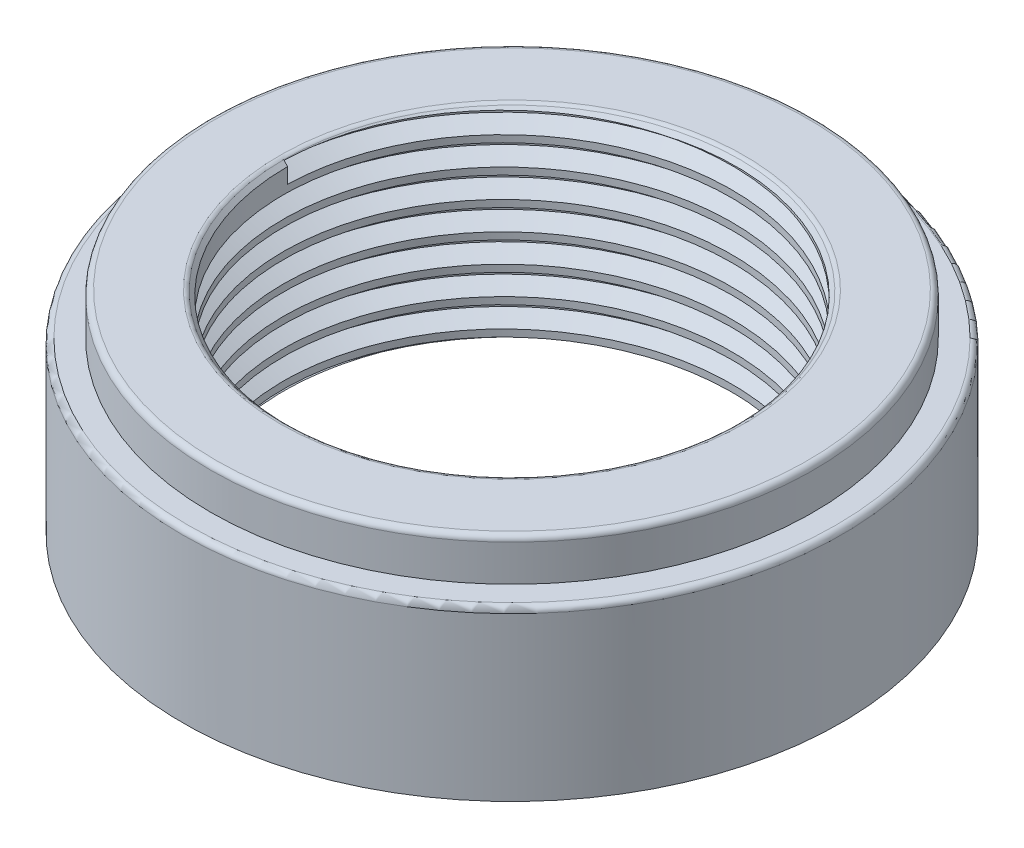
from build123d import *

# Parameters (mm, degrees)
SKETCH1_R           = 29.845
BOSS_EXTRUDE1_DEPTH = 19.05
CUT_EXTRUDE2_START  = -3.81
SKETCH16_R          = 29.845
SKETCH16_R_2        = 27.305
CUT_EXTRUDE2_DEPTH  = 3.81
SKETCH18_R          = 20.32
CUT_EXTRUDE3_DEPTH  = 47.30713282
THREAD2_PITCH       = 2.54
CHAMFER4_SIZE       = 0.508
FILLET3_R           = 0.508


with BuildPart() as part:
    # Sketch1 → Boss-Extrude1 (new body)
    with BuildSketch(Plane(origin=(0, 0, 0), x_dir=(1, 0, 0), z_dir=(0, 1, 0))):
        with Locations(Location((0, 0, 0), (0, 0, 90))):
            Circle(SKETCH1_R)
    extrude(amount=BOSS_EXTRUDE1_DEPTH)

    # Sketch16 → Cut-Extrude2 (cut)
    with BuildSketch(Plane(origin=(0, 19.05, 0), x_dir=(1, 0, 0), z_dir=(0, 1, 0)).offset(CUT_EXTRUDE2_START)):
        with Locations(Location((0, 0, 0), (0, 0, 90))):
            Circle(SKETCH16_R)
        with Locations(Location((0, 0, 0), (0, 0, 270))):
            Circle(SKETCH16_R_2, mode=Mode.SUBTRACT)
    extrude(amount=CUT_EXTRUDE2_DEPTH, mode=Mode.SUBTRACT)

    # Sketch18 → Cut-Extrude3 (cut, through all)
    with BuildSketch(Plane(origin=(0, 19.05, 0), x_dir=(1, 0, 0), z_dir=(0, 1, 0))):
        with Locations(Location((0, 0, 0), (0, 0, 270))):
            Circle(SKETCH18_R)
    extrude(amount=-CUT_EXTRUDE3_DEPTH, mode=Mode.SUBTRACT)

    # Thread2: the profile of Thread Profile2 profile screwed along a right-hand helix of 7.5 turns, 10 arcs to a turn; built about Z, then put on its axis
    thread2_z = Axis((0, 0, 0), (0, 0, 1))
    thread2_corners = [(20.3197, 0, -0.000173205), (21.694815322, 0, 0.793749997), (21.694815322, 0, 1.111249997), (20.3197, 0, 1.905173198)]
    with BuildLine(mode=Mode.PRIVATE) as thread2_profile:
        Line(thread2_corners[0], thread2_corners[1])
        Line(thread2_corners[1], thread2_corners[2])
        Line(thread2_corners[2], thread2_corners[3])
        Line(thread2_corners[3], thread2_corners[0])
    thread2_cap = Face(thread2_profile.wire())
    thread2_turn_angles = [0, 18, 36, 54, 72, 90, 108, 126, 144, 162, 180, 198, 216, 234, 252, 270, 288, 306, 324, 342, 360]
    thread2_turn_weights = [1, 0.9510565162951535, 1, 0.9510565162951535, 1, 0.9510565162951535, 1, 0.9510565162951535, 1, 0.9510565162951535, 1, 0.9510565162951535, 1, 0.9510565162951535, 1, 0.9510565162951535, 1, 0.9510565162951535, 1, 0.9510565162951535, 1]
    thread2_turn_rails = [Edge.make_bspline([Vector(p[0], p[1], 0).rotate(thread2_z, thread2_turn_angles[k]) / thread2_turn_weights[k] + Vector(0, 0, p[2] + THREAD2_PITCH * thread2_turn_angles[k] / 360) for k in range(21)], [0, 0, 0, 1, 1, 2, 2, 3, 3, 4, 4, 5, 5, 6, 6, 7, 7, 8, 8, 9, 9, 10, 10, 10], 2, thread2_turn_weights) for p in thread2_corners]
    thread2_turn_sides = [Face.make_surface_from_curves(thread2_turn_rails[p[0]], thread2_turn_rails[p[1]]) for p in [(0, 1), (1, 2), (2, 3), (3, 0)]]
    thread2_last_angles = [2520, 2538, 2556, 2574, 2592, 2610, 2628, 2646, 2664, 2682, 2700]
    thread2_last_weights = [1, 0.9510565162951535, 1, 0.9510565162951535, 1, 0.9510565162951535, 1, 0.9510565162951535, 1, 0.9510565162951535, 1]
    thread2_last_rails = [Edge.make_bspline([Vector(p[0], p[1], 0).rotate(thread2_z, thread2_last_angles[k]) / thread2_last_weights[k] + Vector(0, 0, p[2] + THREAD2_PITCH * thread2_last_angles[k] / 360) for k in range(11)], [0, 0, 0, 1, 1, 2, 2, 3, 3, 4, 4, 5, 5, 5], 2, thread2_last_weights) for p in thread2_corners]
    thread2_last_sides = [Face.make_surface_from_curves(thread2_last_rails[p[0]], thread2_last_rails[p[1]]) for p in [(0, 1), (1, 2), (2, 3), (3, 0)]]
    thread2 = Plane(origin=(0, 19.05, 0), x_dir=(-1, 0, 0), z_dir=(0, -1, 0)) * Solid(Shell([*[p.moved(Location((0, 0, THREAD2_PITCH * i))) for i in range(7) for p in thread2_turn_sides], *thread2_last_sides, thread2_cap, thread2_cap.rotate(thread2_z, 2700).moved(Location((0, 0, THREAD2_PITCH * 2700 / 360)))]))
    add(thread2, mode=Mode.SUBTRACT)

    # Chamfer4
    # the kernel refuses this chamfer: 0.508 mm, written as the material it takes off along each edge
    with BuildSketch(Plane(origin=(0, 19.05, 0), x_dir=(0, 0, 1), z_dir=(-1, 0, 0))) as chamfer4_piece_1:
        Polygon((20.32 + CHAMFER4_SIZE, 0), (20.32, -CHAMFER4_SIZE), (20.32, 0), align=None)
    revolve(axis=Axis((0, 19.05, 0), (0, 1, 0)), revolution_arc=270, mode=Mode.SUBTRACT)
    with BuildSketch(Plane(origin=(0, 19.05, 0), x_dir=(-1, 0, 0), z_dir=(0, 0, -1))) as chamfer4_piece_2:
        Polygon((20.32 + CHAMFER4_SIZE, 0), (20.32, -CHAMFER4_SIZE), (20.32, 0), align=None)
    revolve(axis=Axis((0, 19.05, 0), (0, 1, 0)), revolution_arc=90, mode=Mode.SUBTRACT)

    # Fillet3
    fillet3_edges = [part.edges().sort_by_distance(p)[0] for p in [
        (20.828, 19.05, 0),
        (0, 15.24, 29.845),
        (0, 19.05, -27.305),
    ]]
    fillet(fillet3_edges, radius=FILLET3_R)


solid = part.part
